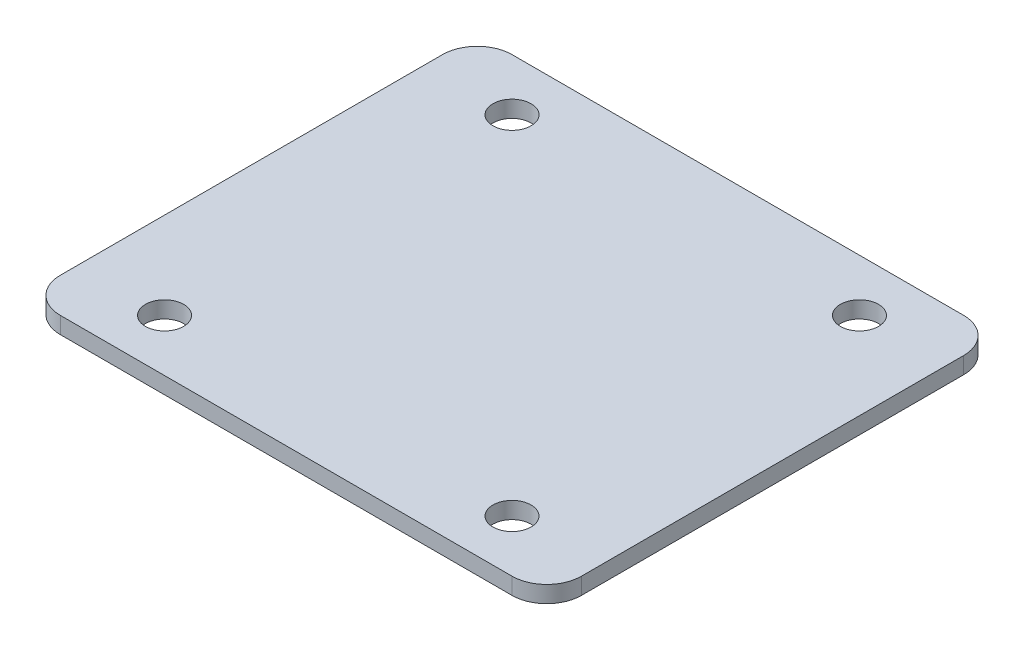
from build123d import *

# Parameters (mm, degrees)
ESBO_O1_R          = 5.5
FLANGE_BASE1_DEPTH = 4.8


# Sheet-metal steps are written as plain solids
with BuildPart() as part:
    # Esboço1 → Flange-base1 (new body)
    with BuildSketch(Plane(origin=(0, 0, 0), x_dir=(1, 0, 0), z_dir=(0, 1, 0))):
        with BuildLine():
            Line((-65, -65), (65, -65))
            ThreePointArc((65, -65), (72.071067812, -62.071067812), (75, -55))
            Line((75, -55), (75, 55))
            ThreePointArc((75, 55), (72.071067812, 62.071067812), (65, 65))
            Line((65, 65), (-65, 65))
            ThreePointArc((-65, 65), (-72.071067812, 62.071067812), (-75, 55))
            Line((-75, 55), (-75, -55))
            ThreePointArc((-75, -55), (-72.071067812, -62.071067812), (-65, -65))
        make_face()
        with Locations(Location((-50, 50, 0), (0, 0, 270))):
            Circle(ESBO_O1_R, mode=Mode.SUBTRACT)
        with Locations(Location((50, 50, 0), (0, 0, 270))):
            Circle(ESBO_O1_R, mode=Mode.SUBTRACT)
        with Locations(Location((50, -50, 0), (0, 0, 270))):
            Circle(ESBO_O1_R, mode=Mode.SUBTRACT)
        with Locations(Location((-50, -50, 0), (0, 0, 270))):
            Circle(ESBO_O1_R, mode=Mode.SUBTRACT)
    extrude(amount=-FLANGE_BASE1_DEPTH)


solid = part.part
